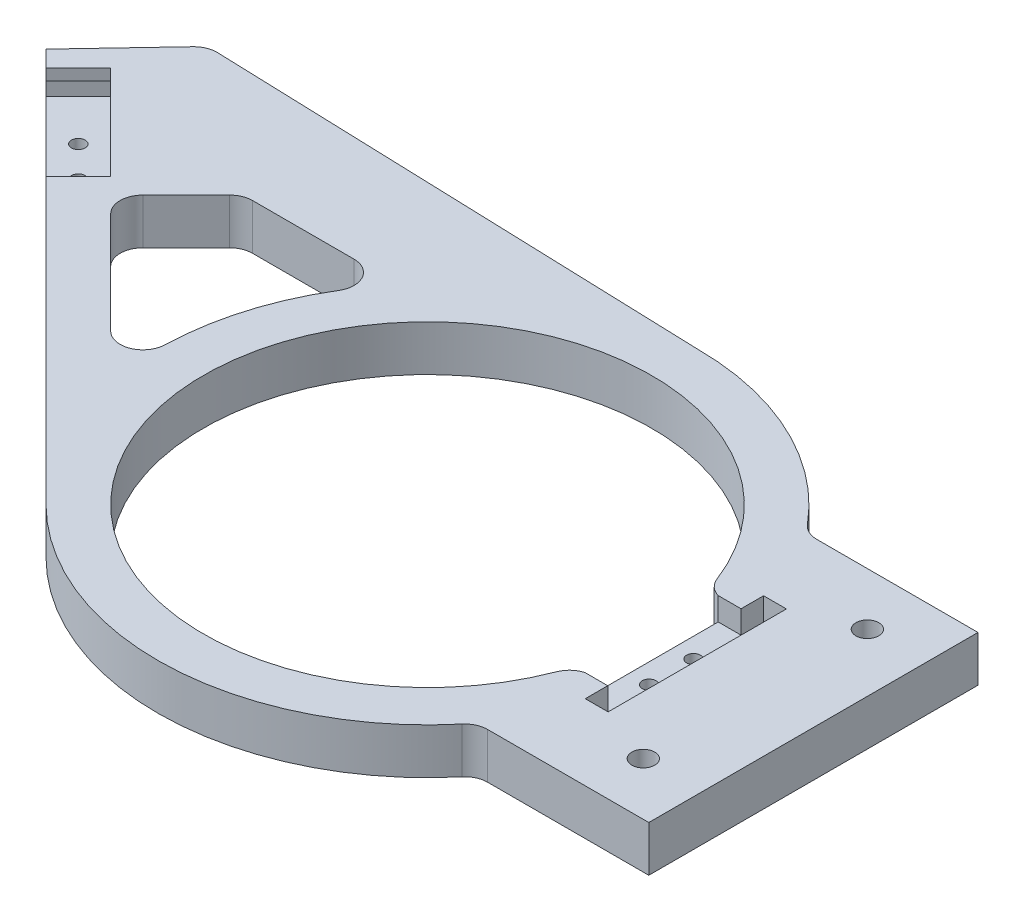
from build123d import *

# Parameters (mm, degrees)
BOSS_EXTRUDE1_DEPTH         = 5
FILLET1_R                   = 5
CUT_EXTRUDE1_DEPTH          = 10
F_3_0MM_DOWEL_HOLE3_D       = 3
CUT_EXTRUDE2_DEPTH          = 5
F_3_0MM_PRESS_DOWEL_HOLE1_D = 3
F_5_0MM_PRESS_DOWEL_HOLE1_D = 5


with BuildPart() as part:
    # Sketch1 → Boss-Extrude1 (new, symmetric)
    with BuildSketch(Plane(origin=(0, 0, 0), x_dir=(1, 0, 0), z_dir=(0, 1, 0))):
        with BuildLine():
            Line((-107.462553071, 24.023952891), (-41.71930009, -41.71930009))
            ThreePointArc((-41.71930009, -41.71930009), (3.806502253, -58.877079926), (46.74398357, -36))
            Line((46.74398357, -36), (84.4, -36))
            Line((84.4, -36), (84.4, 36))
            Line((84.4, 36), (46.74398357, 36))
            ThreePointArc((46.74398357, 36), (26.048032555, 52.93864373), (0, 59))
            Line((0, 59), (-110.83863918, 62.740943777))
            Line((-110.83863918, 62.740943777), (-128.004005064, 44.565404884))
            Line((-128.004005064, 44.565404884), (-107.462553071, 24.023952891))
        make_face()
        with BuildLine():
            Line((49, 14.576290822), (46.781745862, 14.576290822))
            ThreePointArc((46.781745862, 14.576290822), (-49, 0), (46.781745862, -14.576290822))
            Line((46.781745862, -14.576290822), (49, -14.576290822))
            Line((49, -14.576290822), (49, 14.576290822))
        make_face(mode=Mode.SUBTRACT)
        with BuildLine():
            Line((-93.296148974, 23.999684418), (-57.886132355, -11.410332201))
            ThreePointArc((-57.886132355, -11.410332201), (-57.048958802, 15.047135926), (-44.728269399, 38.475731527))
            Line((-44.728269399, 38.475731527), (-78.820101865, 38.475731527))
            Line((-78.820101865, 38.475731527), (-93.296148974, 23.999684418))
        make_face(mode=Mode.SUBTRACT)
    extrude(amount=BOSS_EXTRUDE1_DEPTH, both=True)

    # Fillet1
    # the kernel refuses this fillet: 5 mm, written as the material it adds along each edge
    with BuildSketch(Plane(origin=(46.74398357, -5, 36), x_dir=(1, 0, 0), z_dir=(0, 1, 0))) as fillet1_piece_1:
        with BuildLine():
            CenterArc((2.398665931, -5), FILLET1_R, 90, 50.161560023)
            ThreePointArc((-1.440603561, -1.796875), (-0.711533327, -0.905467408), (0, 0))
            Line((0, 0), (2.398665931, 0))
        make_face()
    extrude(amount=10)
    with BuildSketch(Plane(origin=(46.74398357, -5, -36), x_dir=(-0.6255163967442842, 0, -0.7802110210731757), z_dir=(0, 1, 0))) as fillet1_piece_2:
        with BuildLine():
            CenterArc((2.400650235, -4.999047579), FILLET1_R, 91.118340331, 50.161560023)
            Line((-1.50040487, -1.871465595), (0, 0))
            ThreePointArc((0, 0), (1.151531414, -0.011238567), (2.303062827, 0))
        make_face()
    extrude(amount=10)
    with BuildSketch(Plane(origin=(-93.296148974, -5, -23.999684418), x_dir=(0.7071067811865481, 0, -0.7071067811865468), z_dir=(0, 1, 0))) as fillet1_piece_3:
        with BuildLine():
            CenterArc((FILLET1_R, -FILLET1_R), FILLET1_R, 90, 90)
            Line((0, -FILLET1_R), (0, 0))
            Line((0, 0), (FILLET1_R, 0))
        make_face()
    extrude(amount=10)
    with BuildSketch(Plane(origin=(-78.820101865, -5, -38.475731527), x_dir=(1, 0, 0), z_dir=(0, 1, 0))) as fillet1_piece_4:
        with BuildLine():
            CenterArc((FILLET1_R * 0.414213562373, -FILLET1_R), FILLET1_R, 90, 45)
            Line((-FILLET1_R * 0.292893218813, -FILLET1_R * 0.292893218813), (0, 0))
            Line((0, 0), (FILLET1_R * 0.414213562373, 0))
        make_face()
    extrude(amount=10)
    with BuildSketch(Plane(origin=(-57.886132355, 5, 11.410332201), x_dir=(-0.08353472888006676, 0, -0.9965048665565731), z_dir=(0, -1, 0))) as fillet1_piece_5:
        with BuildLine():
            CenterArc((13.623707644, -4.969234882), FILLET1_R, 96.359234778, 133.432536558)
            Line((10.395870767, -8.787751491), (0, 0))
            ThreePointArc((0, 0), (6.534949195, -0.363028395), (13.06989839, 0))
        make_face()
    extrude(amount=10)
    with BuildSketch(Plane(origin=(-44.728269399, -5, -38.475731527), x_dir=(-0.5894789818981541, 0, 0.807783714802617), z_dir=(0, 1, 0))) as fillet1_piece_6:
        with BuildLine():
            CenterArc((9.826854917, -4.984017175), FILLET1_R, 94.582422839, 121.53762105)
            Line((5.787936343, -7.931412084), (0, 0))
            ThreePointArc((0, 0), (4.713694635, -0.18859734), (9.42738927, 0))
        make_face()
    extrude(amount=10)
    # the kernel refuses this fillet: 5 mm, written as the material it takes off along each edge
    with BuildSketch(Plane(origin=(46.781745862, 12.95259813, 14.576290822), x_dir=(-0.32830869078175484, 0, 0.9445704862831413), z_dir=(0, -1, 0)), Plane(origin=(46.781745862, -12.95259813, -14.576290822), x_dir=(-0.32830869078175745, 0, -0.9445704862831404), z_dir=(0, 1, 0))) as fillet1_2_piece_1:
        with BuildLine():
            CenterArc((3.343337173, -4.997365244), FILLET1_R, 91.860123923, 52.660239811)
            Line((-0.728272112, -2.09529739), (0, 0))
            ThreePointArc((0, 0), (1.590519626, -0.025820606), (3.181039252, 0))
        make_face()
    extrude(amount=25.90519626, mode=Mode.SUBTRACT)
    with BuildSketch(Plane(origin=(-110.83863918, 10.640073082, -62.740943777), x_dir=(-0.6866146353868613, 0, 0.7270215557138366), z_dir=(0, -1, 0))) as fillet1_2_piece_2:
        with BuildLine():
            CenterArc((FILLET1_R * 0.451205846565, -FILLET1_R), FILLET1_R, 90, 48.570349235)
            Line((-FILLET1_R * 0.298562891452, -FILLET1_R * 0.338300038165), (0, 0))
            Line((0, 0), (FILLET1_R * 0.451205846565, 0))
        make_face()
    extrude(amount=21.280146164, mode=Mode.SUBTRACT)

    # Sketch11 → Cut-Extrude1 (cut)
    with BuildSketch(Plane(origin=(-41.71930009, 0, 41.71930009), x_dir=(0.7071067811865458, 0, 0.7071067811865492), z_dir=(-0.7071067811865492, 0, 0.7071067811865458))):
        Polygon((-116.963470882, 5), (-116.963470882, 2.5), (-119.963470882, 2.5), (-119.963470882, -2.5), (-84.963470882, -2.5), (-84.963470882, 2.5), (-87.963470882, 2.5), (-87.963470882, 5), align=None)
    extrude(amount=-CUT_EXTRUDE1_DEPTH, mode=Mode.SUBTRACT)

    # Ø3.0mm Dowel Hole3 (through all)
    with Locations(Plane(origin=(-113.995138479, -2.5, -37.627606111), x_dir=(0, 0, 1), z_dir=(0, 1, 0))):
        with Locations((0, 0), (6.717514421, 6.717514421)):
            Hole(F_3_0MM_DOWEL_HOLE3_D / 2)

    # Sketch33 → Cut-Extrude2 (cut)
    with BuildSketch(Plane(origin=(0, 5, 0), x_dir=(1, 0, 0), z_dir=(0, 1, 0))):
        Polygon((59, 19.5), (59, -19.5), (54, -19.5), (54, -14.576290822), (49, -14.576290822), (49, 14.576290822), (54, 14.576290822), (54, 19.5), align=None)
    extrude(amount=-CUT_EXTRUDE2_DEPTH, mode=Mode.SUBTRACT)

    # Ø3.0mm Press Dowel Hole1 (through all)
    with Locations(Plane(origin=(53.32762779, -5, -4.850211912), x_dir=(0, 0, -1), z_dir=(0, -1, 0))):
        with Locations((0, 0), (-9.700423824, 0)):
            Hole(F_3_0MM_PRESS_DOWEL_HOLE1_D / 2)

    # Ø5.0mm Press Dowel Hole1 (through all)
    with Locations(Plane(origin=(71.7, 5, 24.5), x_dir=(0, 0, 1), z_dir=(0, 1, 0))):
        with Locations((0, 0), (-49, 0)):
            Hole(F_5_0MM_PRESS_DOWEL_HOLE1_D / 2)


solid = part.part
